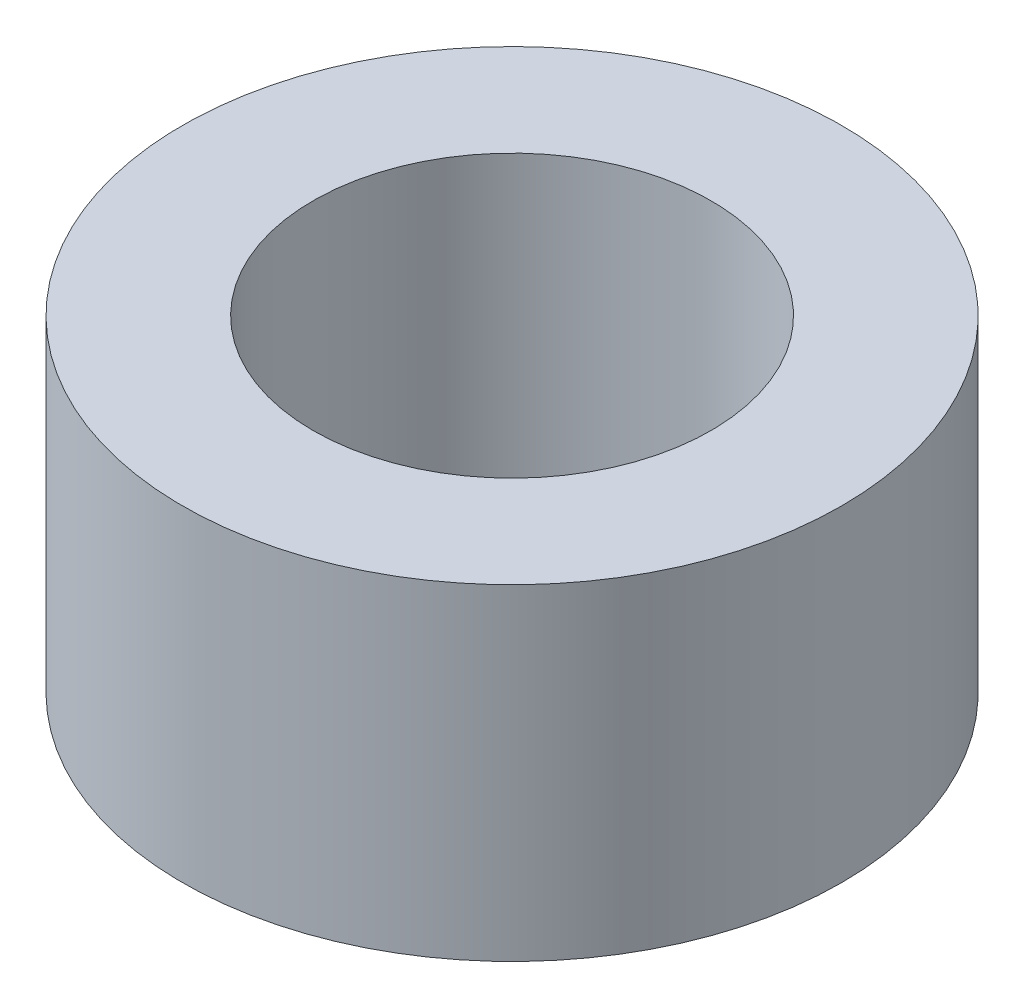
from build123d import *

# Parameters (mm, degrees)
SKETCH1_R           = 5.05
SKETCH1_R_2         = 3.05
EXTRUDE_THIN1_DEPTH = 5


with BuildPart() as part:
    # Sketch1 → Extrude-Thin1 (new body)
    with BuildSketch(Plane(origin=(0, 0, 0), x_dir=(1, 0, 0), z_dir=(0, 1, 0))):
        Circle(SKETCH1_R)
        Circle(SKETCH1_R_2, mode=Mode.SUBTRACT)
    extrude(amount=EXTRUDE_THIN1_DEPTH)


solid = part.part
